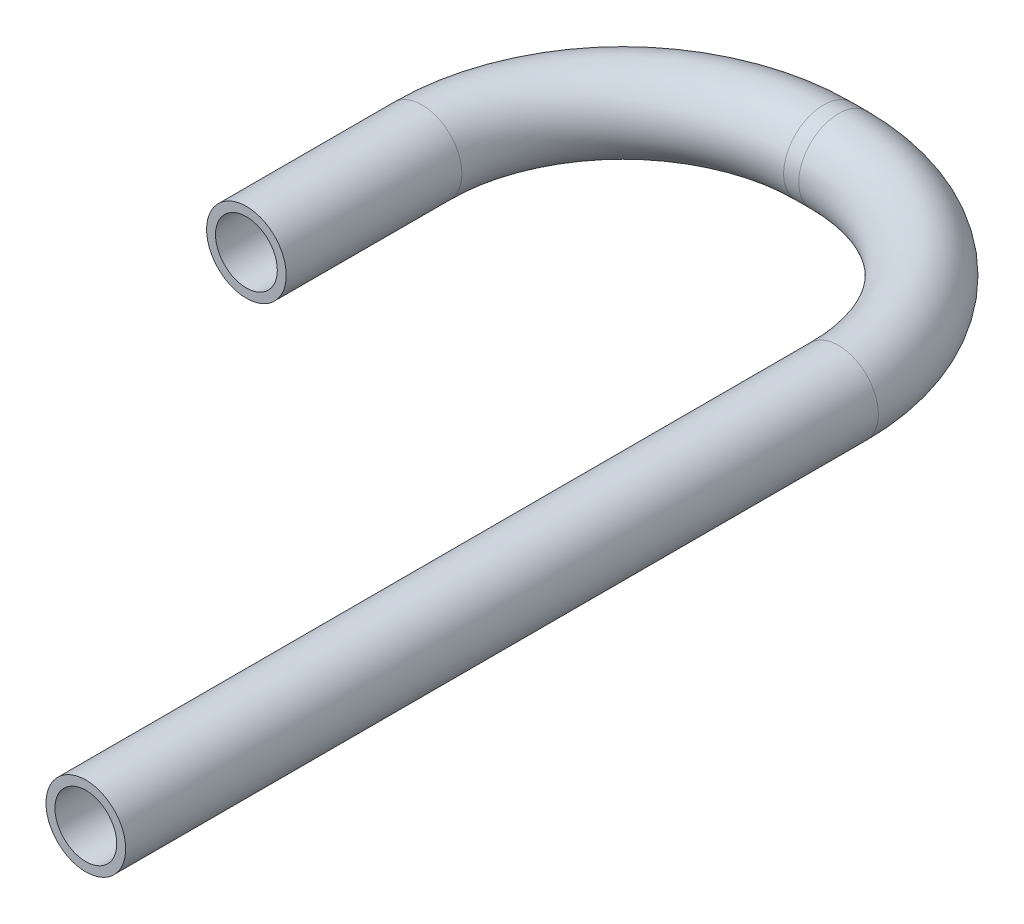
from build123d import *

# Parameters (mm, degrees)
SKETCH2_R   = 3.175
SKETCH2_R_2 = 2.4638


with BuildPart() as part:
    # Sweep-Thin1: sweep along a path in Sketch1
    with BuildLine(Plane(origin=(0, 0, 0), x_dir=(1, 0, 0), z_dir=(0, 1, 0))) as sweep_thin1_path:
        Line((0, 0), (0, 14))
        ThreePointArc((0, 14), (4.686291501, 25.313708499), (16, 30))
        Line((16, 30), (17.2, 30))
        ThreePointArc((17.2, 30), (28.513708499, 25.313708499), (33.2, 14))
        Line((33.2, 14), (33.2, -46))
    # Sketch2 → Sweep-Thin1 (sweep)
    with BuildSketch(Plane.XY):
        Circle(SKETCH2_R)
        Circle(SKETCH2_R_2, mode=Mode.SUBTRACT)
    sweep(path=sweep_thin1_path.line)


solid = part.part
